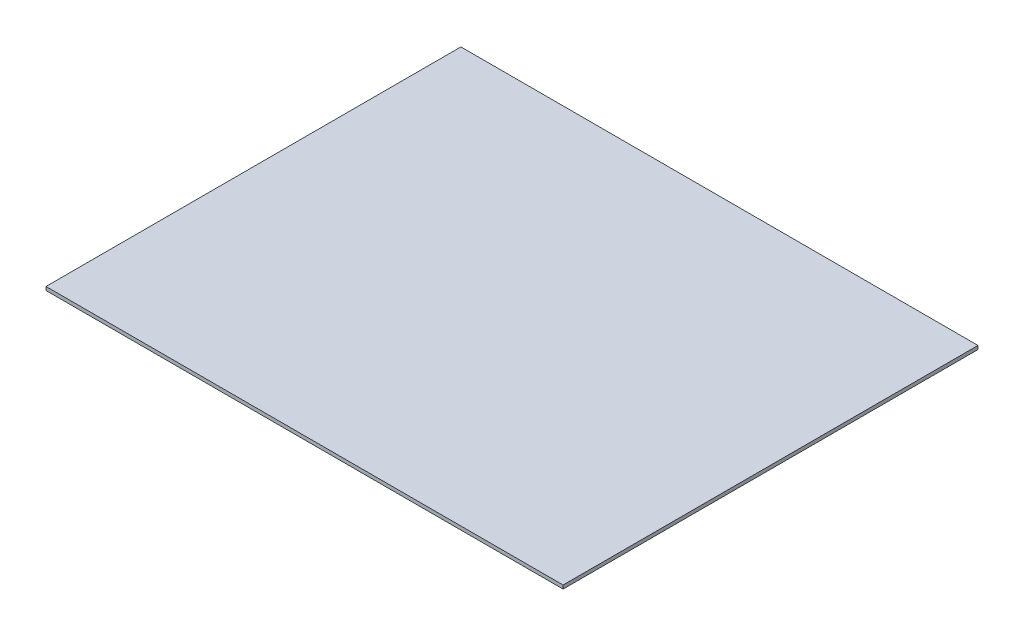
from build123d import *

# Parameters (mm, degrees)
SKETCH1_W           = 248
SKETCH1_H           = 199
BOSS_EXTRUDE1_DEPTH = 1.7


with BuildPart() as part:
    # Sketch1 → Boss-Extrude1 (new body)
    with BuildSketch(Plane(origin=(0, 0, 0), x_dir=(1, 0, 0), z_dir=(0, 1, 0))):
        Rectangle(SKETCH1_W, SKETCH1_H)
    extrude(amount=BOSS_EXTRUDE1_DEPTH)


solid = part.part
